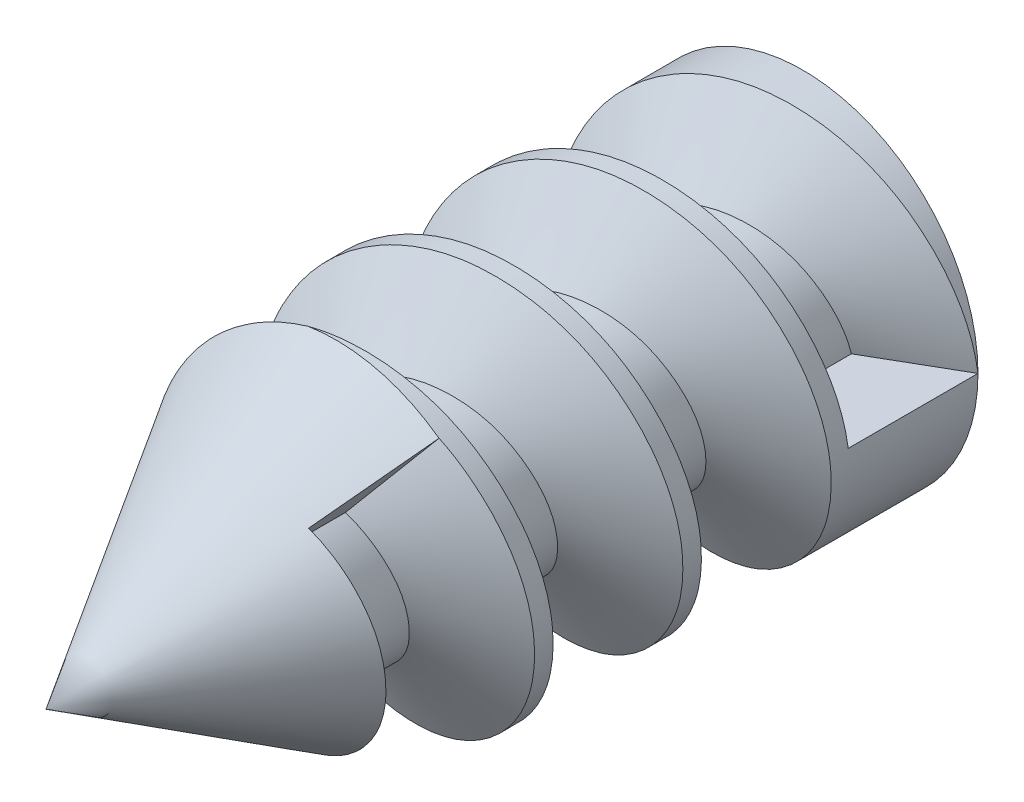
from build123d import *

# Parameters (mm, degrees)
SKETCH_1_R      = 1.5
EXTRUDE_1_DEPTH = 4
THREAD_1_PITCH  = 1.27


with BuildPart() as part:
    # Sketch 1 → 凸台-拉伸1 (new body)
    with BuildSketch(Plane.XY):
        Circle(SKETCH_1_R)
    extrude(amount=EXTRUDE_1_DEPTH)

    # 草图2 → 旋转1 (revolve)
    with BuildSketch(Plane(origin=(0, 0, 0), x_dir=(0, 0, -1), z_dir=(1, 0, 0)), mode=Mode.PRIVATE) as revolve_1_sk:
        Polygon((-4, 0), (-6.480992671, 0), (-4, -1.5), align=None)
    revolve(revolve_1_sk.sketch.rotate(Axis((0, 0, 4), (0, 0, 1)), 270), axis=Axis((0, 0, 4), (0, 0, 1)))

    # 螺纹线1: the profile of Sketch 1 2 profile screwed along a right-hand helix of 3.149606 turns, 8 arcs to a turn; built about Z, then put on its axis
    thread_1_z = Axis((0, 0, 0), (0, 0, 1))
    thread_1_corners = [(1.5003, 0, -0.000173205), (1.5003, 0, 1.111423202), (0.812592339, 0, 0.714374998), (0.812592339, 0, 0.396874998)]
    with BuildLine(mode=Mode.PRIVATE) as thread_1_profile:
        Line(thread_1_corners[0], thread_1_corners[1])
        Line(thread_1_corners[1], thread_1_corners[2])
        Line(thread_1_corners[2], thread_1_corners[3])
        Line(thread_1_corners[3], thread_1_corners[0])
    thread_1_cap = Face(thread_1_profile.wire())
    thread_1_turn_angles = [0, 22.5, 45, 67.5, 90, 112.5, 135, 157.5, 180, 202.5, 225, 247.5, 270, 292.5, 315, 337.5, 360]
    thread_1_turn_weights = [1, 0.9238795325112867, 1, 0.9238795325112867, 1, 0.9238795325112867, 1, 0.9238795325112867, 1, 0.9238795325112867, 1, 0.9238795325112867, 1, 0.9238795325112867, 1, 0.9238795325112867, 1]
    thread_1_turn_rails = [Edge.make_bspline([Vector(p[0], p[1], 0).rotate(thread_1_z, thread_1_turn_angles[k]) / thread_1_turn_weights[k] + Vector(0, 0, p[2] + THREAD_1_PITCH * thread_1_turn_angles[k] / 360) for k in range(17)], [0, 0, 0, 1, 1, 2, 2, 3, 3, 4, 4, 5, 5, 6, 6, 7, 7, 8, 8, 8], 2, thread_1_turn_weights) for p in thread_1_corners]
    thread_1_turn_sides = [Face.make_surface_from_curves(thread_1_turn_rails[p[0]], thread_1_turn_rails[p[1]]) for p in [(0, 1), (1, 2), (2, 3), (3, 0)]]
    thread_1_last_angles = [1080, 1102.5, 1125, 1129.429133858, 1133.858267717]
    thread_1_last_weights = [1, 0.9238795325112867, 1, 0.9970136131070448, 1]
    thread_1_last_rails = [Edge.make_bspline([Vector(p[0], p[1], 0).rotate(thread_1_z, thread_1_last_angles[k]) / thread_1_last_weights[k] + Vector(0, 0, p[2] + THREAD_1_PITCH * thread_1_last_angles[k] / 360) for k in range(5)], [0, 0, 0, 1, 1, 2, 2, 2], 2, thread_1_last_weights) for p in thread_1_corners]
    thread_1_last_sides = [Face.make_surface_from_curves(thread_1_last_rails[p[0]], thread_1_last_rails[p[1]]) for p in [(0, 1), (1, 2), (2, 3), (3, 0)]]
    thread_1 = Plane(origin=(0, 0, 0), x_dir=(1, 0, 0), z_dir=(0, 0, 1)) * Solid(Shell([*[p.moved(Location((0, 0, THREAD_1_PITCH * i))) for i in range(3) for p in thread_1_turn_sides], *thread_1_last_sides, thread_1_cap, thread_1_cap.rotate(thread_1_z, 1133.858267717).moved(Location((0, 0, THREAD_1_PITCH * 1133.858267717 / 360)))]))
    add(thread_1, mode=Mode.SUBTRACT)


solid = part.part
